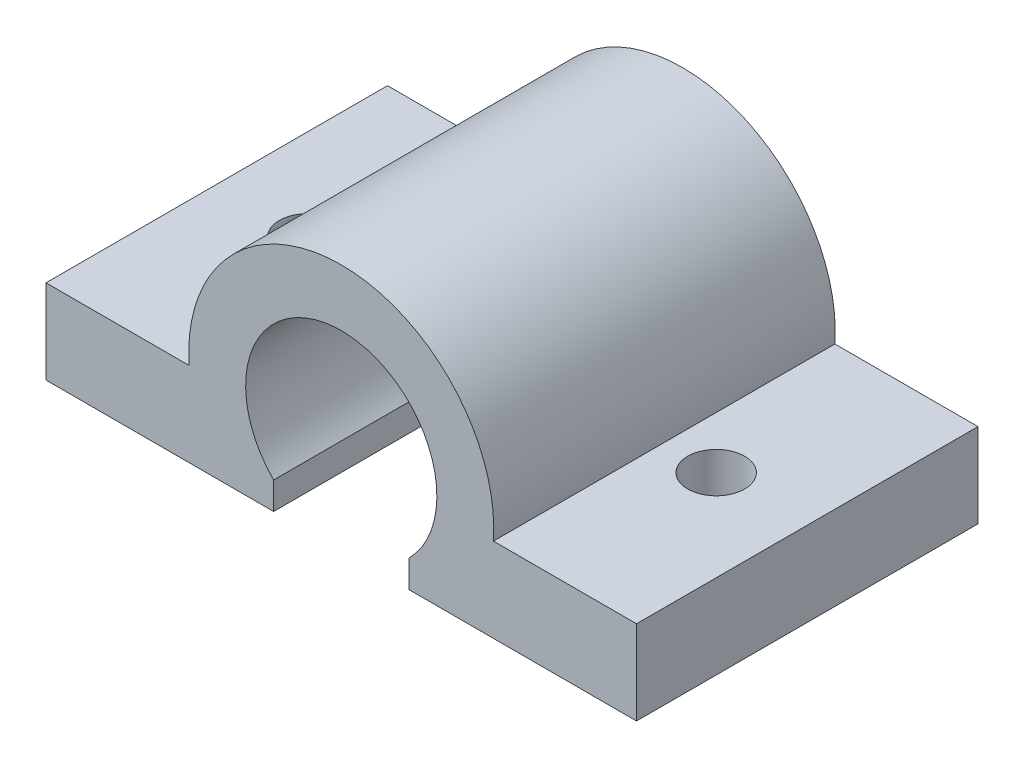
from build123d import *
from build123d.topology import SkipClean

# Parameters (mm, degrees)
BOSS_EXTRUDE1_DEPTH      = 38.1
SKETCH2_R                = 3.175
CUT_EXTRUDE1_DEPTH       = 38.1
SKETCH3_R                = 3.175
CUT_EXTRUDE2_DEPTH       = 59.50170141
SKETCH12_W               = 25.4
SKETCH12_H               = 38.1
SKETCH12_R               = 3.175
BOSS_EXTRUDE3_DEPTH      = 3.048
BOSS_EXTRUDE4_DEPTH      = 9.525
BOSS_EXTRUDE5_DEPTH      = 9.525
BOSS_EXTRUDE5_DEPTH_BACK = 9.525


with BuildPart() as part:
    # Sketch1 → Boss-Extrude1 (new body)
    with BuildSketch(Plane.XY):
        with BuildLine():
            Line((0, 0), (-25.4, 0))
            Line((-25.4, 0), (-25.4, 6.35))
            Line((-25.4, 6.35), (-9.432688189, 6.35))
            ThreePointArc((-9.432688189, 6.35), (7.543415142, 24.561415142), (24.519518473, 6.35))
            Line((24.519518473, 6.35), (40.486830283, 6.35))
            Line((40.486830283, 6.35), (40.486830283, 0))
            Line((40.486830283, 0), (15.086830283, 0))
            ThreePointArc((15.086830283, 0), (7.543415142, 18.211415142), (0, 0))
        make_face()
    extrude(amount=BOSS_EXTRUDE1_DEPTH)

    # Sketch2 → Cut-Extrude1 (cut)
    with BuildSketch(Plane(origin=(0, 6.35, 0), x_dir=(1, 0, 0), z_dir=(0, 1, 0))):
        with Locations((30.326830283, -19.05)):
            Circle(SKETCH2_R)
    extrude(amount=-CUT_EXTRUDE1_DEPTH, mode=Mode.SUBTRACT)

    # Sketch3 → Cut-Extrude2 (cut, through all)
    with BuildSketch(Plane(origin=(0, 6.35, 0), x_dir=(1, 0, 0), z_dir=(0, 1, 0))):
        with Locations((-15.24, -19.05)):
            Circle(SKETCH3_R)
    extrude(amount=-CUT_EXTRUDE2_DEPTH, mode=Mode.SUBTRACT)

    # Sketch12 → Boss-Extrude3 (add)
    # profile 1 of 2: a face of its own
    with SkipClean():  # the faces are left unmerged after this step: merging them gives an invalid solid
        with BuildSketch(Plane(origin=(0, 0, 0), x_dir=(-1, 0, 0), z_dir=(0, -1, 0))):
            with Locations((12.7, -19.05)):
                Rectangle(SKETCH12_W, SKETCH12_H)
            with Locations((15.24, -19.05)):
                Circle(SKETCH12_R, mode=Mode.SUBTRACT)
        # profile 2 of 2: a face of its own
        with BuildSketch(Plane(origin=(0, 0, 0), x_dir=(-1, 0, 0), z_dir=(0, -1, 0))):
            with Locations((-27.786830283, -19.05)):
                Rectangle(SKETCH12_W, SKETCH12_H)
            with Locations((-30.326830283, -19.05)):
                Circle(SKETCH12_R, mode=Mode.SUBTRACT)
        extrude(amount=BOSS_EXTRUDE3_DEPTH)

    # Sketch5 → Boss-Extrude4 (add)
    with SkipClean():  # the faces are left unmerged after this step: merging them gives an invalid solid
        with BuildSketch(Plane(origin=(0, 0, 0), x_dir=(-1, 0, 0), z_dir=(0, 0, -1))):
            with BuildLine():
                Line((-15.086830283, 0), (-12.064230283, 0))
                Line((-12.064230283, 0), (-12.949529327, 2.137300957))
                ThreePointArc((-12.949529327, 2.137300957), (-7.543415142, 15.188815142), (-2.137300957, 2.137300957))
                Line((-2.137300957, 2.137300957), (-3.0226, 0))
                Line((-3.0226, 0), (0, 0))
                ThreePointArc((0, 0), (-7.543415142, 18.211415142), (-15.086830283, 0))
            make_face()
        extrude(amount=-BOSS_EXTRUDE4_DEPTH)

    # Sketch14 → Boss-Extrude5 (add, two sides: drawn at the far end of the back side and taken through both)
    with SkipClean():  # the faces are left unmerged after this step: merging them gives an invalid solid
        with BuildSketch(Plane.XY.offset(9.525).offset(-BOSS_EXTRUDE5_DEPTH_BACK)):
            with BuildLine():
                Line((3.484339375, 3.484339375), (2.137300957, 2.137300957))
                ThreePointArc((2.137300957, 2.137300957), (7.543415142, 15.188815142), (12.949529327, 2.137300957))
                Line((12.949529327, 2.137300957), (11.602490908, 3.484339375))
                ThreePointArc((11.602490908, 3.484339375), (7.543415142, 13.283815142), (3.484339375, 3.484339375))
            make_face()
        extrude(amount=BOSS_EXTRUDE5_DEPTH + BOSS_EXTRUDE5_DEPTH_BACK)


solid = part.part
